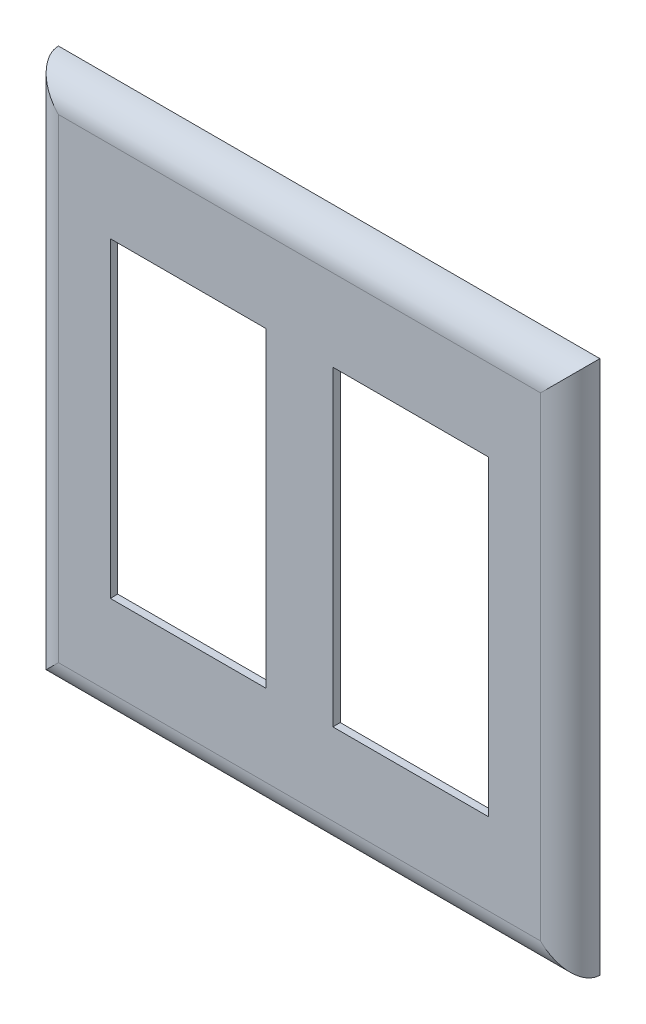
from build123d import *

# Parameters (mm, degrees)
SKETCH1_W           = 115.8875
SKETCH1_H           = 114.3
SKETCH1_W_2         = 33.3375
SKETCH1_H_2         = 66.675
BOSS_EXTRUDE1_DEPTH = 6.35
SKETCH2_W           = 112.7125
SKETCH2_H           = 111.125
CUT_EXTRUDE1_DEPTH  = 4.7625
FILLET2_R           = 6.35


with BuildPart() as part:
    # Sketch1 → Boss-Extrude1 (new body)
    with BuildSketch(Plane.XY):
        Rectangle(SKETCH1_W, SKETCH1_H)
        with Locations((-23.820216951, 0)):
            Rectangle(SKETCH1_W_2, SKETCH1_H_2, mode=Mode.SUBTRACT)
        with Locations((23.8125, 0)):
            Rectangle(SKETCH1_W_2, SKETCH1_H_2, mode=Mode.SUBTRACT)
    extrude(amount=BOSS_EXTRUDE1_DEPTH)

    # Sketch2 → Cut-Extrude1 (cut)
    with BuildSketch(Plane(origin=(0, 0, 0), x_dir=(-1, 0, 0), z_dir=(0, 0, -1))):
        Rectangle(SKETCH2_W, SKETCH2_H)
    extrude(amount=-CUT_EXTRUDE1_DEPTH, mode=Mode.SUBTRACT)

    # Fillet2
    # the kernel refuses this fillet: 6.35 mm, written as the material it adds along each edge
    with BuildSketch(Plane(origin=(56.35625, -55.5625, 4.7625), x_dir=(0, 0, -1), z_dir=(-1, 0, 0)), Plane(origin=(-56.35625, 55.5625, 4.7625), x_dir=(0, 0, -1), z_dir=(1, 0, 0))) as fillet2_piece_1:
        with BuildLine():
            CenterArc((6.35, -6.148361062), FILLET2_R, 104.477512186, 75.522487814)
            Line((0, -6.148361062), (0, 0))
            Line((0, 0), (4.7625, 0))
        make_face()
    extrude(amount=112.7125)
    with BuildSketch(Plane(origin=(-56.35625, -55.5625, 4.7625), x_dir=(0, 0, -1), z_dir=(0, 1, 0)), Plane(origin=(56.35625, 55.5625, 4.7625), x_dir=(0, 0, -1), z_dir=(0, -1, 0))) as fillet2_piece_2:
        with BuildLine():
            CenterArc((6.35, -6.148361062), FILLET2_R, 104.477512186, 75.522487814)
            Line((0, -6.148361062), (0, 0))
            Line((0, 0), (4.7625, 0))
        make_face()
    extrude(amount=111.125)
    # the kernel refuses this fillet: 6.35 mm, written as the material it takes off along each edge
    with BuildSketch(Plane(origin=(-73.81875, 57.15, 6.35), x_dir=(0, 0, -1), z_dir=(1, 0, 0))) as fillet2_2_piece_1:
        with BuildLine():
            CenterArc((FILLET2_R, -FILLET2_R), FILLET2_R, 90, 90)
            Line((0, -FILLET2_R), (0, 0))
            Line((0, 0), (FILLET2_R, 0))
        make_face()
    extrude(amount=147.6375, mode=Mode.SUBTRACT)
    with BuildSketch(Plane(origin=(-57.94375, -73.025, 6.35), x_dir=(0, 0, -1), z_dir=(0, 1, 0)), Plane(origin=(57.94375, 73.025, 6.35), x_dir=(0, 0, -1), z_dir=(0, -1, 0))) as fillet2_2_piece_2:
        with BuildLine():
            CenterArc((FILLET2_R, -FILLET2_R), FILLET2_R, 90, 90)
            Line((0, -FILLET2_R), (0, 0))
            Line((0, 0), (FILLET2_R, 0))
        make_face()
    extrude(amount=146.05, mode=Mode.SUBTRACT)
    with BuildSketch(Plane(origin=(73.81875, -57.15, 6.35), x_dir=(0, 1, 0), z_dir=(-1, 0, 0))) as fillet2_2_piece_3:
        with BuildLine():
            CenterArc((FILLET2_R, FILLET2_R), FILLET2_R, 180, 90)
            Line((0, FILLET2_R), (0, 0))
            Line((0, 0), (FILLET2_R, 0))
        make_face()
    extrude(amount=147.6375, mode=Mode.SUBTRACT)


solid = part.part
